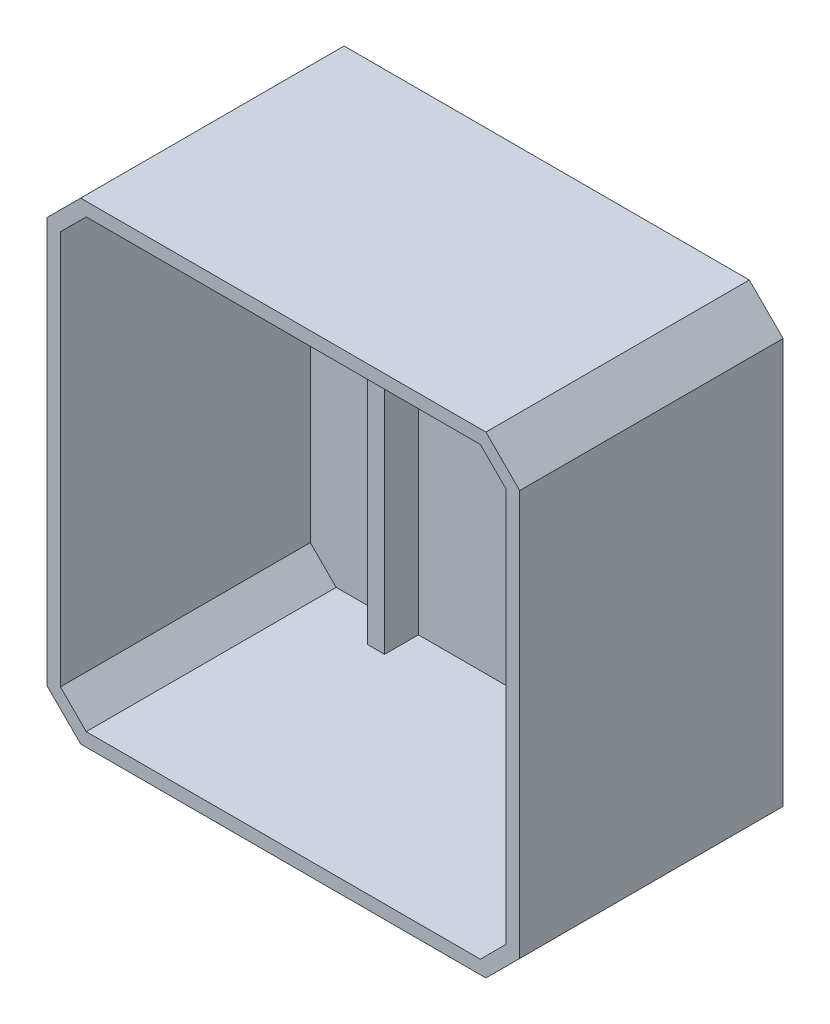
from build123d import *

# Parameters (mm, degrees)
SKETCH1_W           = 70
SKETCH1_H           = 70
BOSS_EXTRUDE1_DEPTH = 39
CHAMFER1_SIZE       = 5
SHELL1_T            = -2
SKETCH3_W           = 2.5
SKETCH3_H           = 66
BOSS_EXTRUDE2_DEPTH = 5


with BuildPart() as part:
    # Sketch1 → Boss-Extrude1 (new body)
    with BuildSketch(Plane.XY):
        with Locations((86.822194683, -0.073375262)):
            Rectangle(SKETCH1_W, SKETCH1_H)
    extrude(amount=-BOSS_EXTRUDE1_DEPTH)

    # Chamfer1
    chamfer1_edges = [part.edges().sort_by_distance(p)[0] for p in [
        (121.822194683, -35.073375262, -19.5),
        (51.822194683, -35.073375262, -19.5),
        (51.822194683, 34.926624738, -19.5),
        (121.822194683, 34.926624738, -19.5),
    ]]
    chamfer(chamfer1_edges, length=CHAMFER1_SIZE)

    # Shell1
    shell1_openings = [part.faces().sort_by_distance(p)[0] for p in [
        (86.822194683, -0.073375262, 0),
    ]]
    offset(amount=SHELL1_T, openings=shell1_openings, kind=Kind.INTERSECTION)

    # Sketch3 → Boss-Extrude2 (add)
    with BuildSketch(Plane.XY.offset(-37)):
        with Locations((68.572194683, -0.073375262)):
            Rectangle(SKETCH3_W, SKETCH3_H)
        with Locations((105.072194683, -0.073375262)):
            Rectangle(SKETCH3_W, SKETCH3_H)
    extrude(amount=BOSS_EXTRUDE2_DEPTH)


solid = part.part
